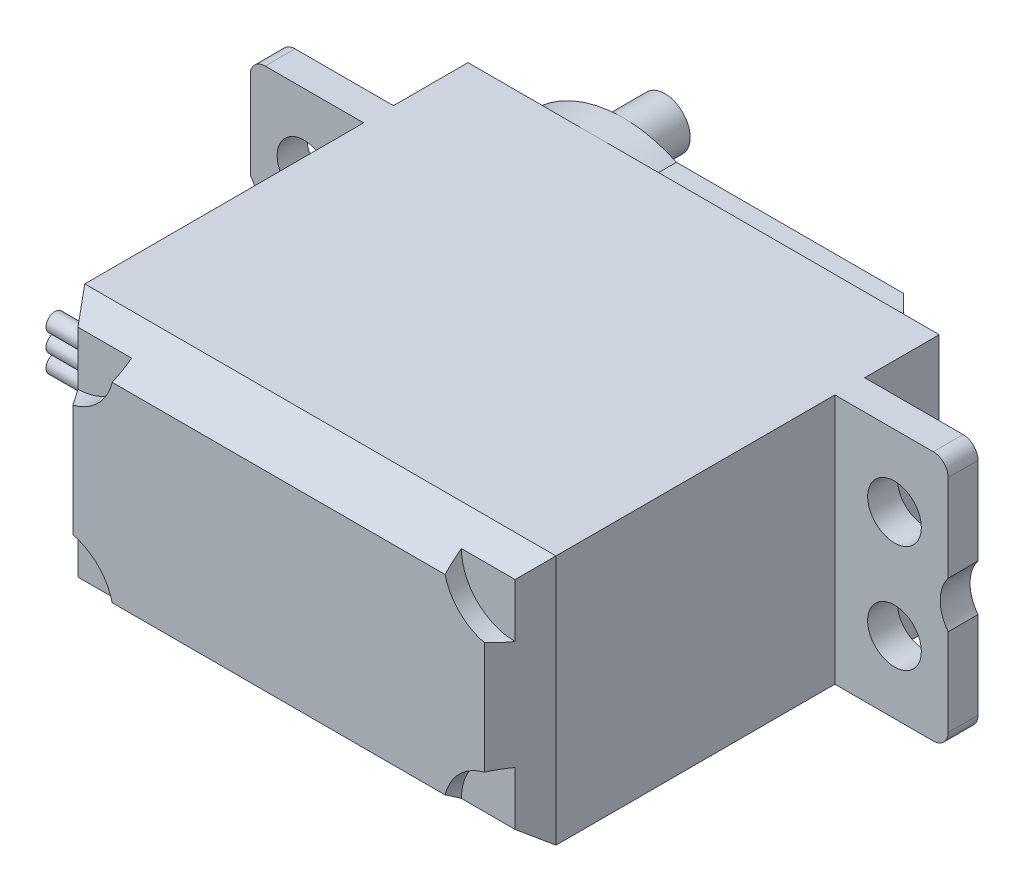
from build123d import *
from OCP.BRepFilletAPI import BRepFilletAPI_MakeChamfer

# Parameters (mm, degrees)
SKETCH1_W           = 40.132
SKETCH1_H           = 21.336
BOSS_EXTRUDE1_DEPTH = 36.195
BOSS_EXTRUDE3_DEPTH = 2.54
CHAMFER1_SIZE       = 2.54
SKETCH7_R           = 2.286
BOSS_EXTRUDE4_DEPTH = 2.54
CHAMFER2_SIZE       = 3.556
CHAMFER2_SIZE2      = 2.54
CUT_EXTRUDE11_REACH = 53.909
BOSS_EXTRUDE5_DEPTH = 1.524
SKETCH14_R          = 2.159
SKETCH14_R_2        = 1.016
BOSS_EXTRUDE6_DEPTH = 2.032
SKETCH15_R          = 3.048
SKETCH15_R_2        = 1.27
BOSS_EXTRUDE7_DEPTH = 3.556
BOSS_EXTRUDE8_DEPTH = 7.62


with BuildPart() as part:
    # Sketch1 → Boss-Extrude1 (new body)
    with BuildSketch(Plane.XY):
        with Locations((-2.744373002, 5.334902309)):
            Rectangle(SKETCH1_W, SKETCH1_H)
    extrude(amount=BOSS_EXTRUDE1_DEPTH)

    # Sketch6 → Boss-Extrude3 (add)
    with BuildSketch(Plane(origin=(0, 0, 0), x_dir=(-1, 0, 0), z_dir=(0, 0, -1))):
        with BuildLine():
            Line((7.598682871, 14.986902309), (-14.273626998, 14.986902309))
            Line((-14.273626998, 14.986902309), (-14.273626998, -4.317097691))
            Line((-14.273626998, -4.317097691), (7.598682871, -4.317097691))
            ThreePointArc((7.598682871, -4.317097691), (22.810373002, 5.334902309), (7.598682871, 14.986902309))
        make_face()
    extrude(amount=BOSS_EXTRUDE3_DEPTH)

    # Chamfer1
    chamfer1_edges = [part.edges().sort_by_distance(p)[0] for p in [
        (14.273626998, 5.334902309, -2.54),
    ]]
    chamfer(chamfer1_edges, length=CHAMFER1_SIZE - 0.0001)  # a hair under: the kernel refuses the full size

    # Sketch7 → Boss-Extrude4 (add)
    with BuildSketch(Plane(origin=(0, 0, 8.89), x_dir=(-1, 0, 0), z_dir=(0, 0, -1))):
        with BuildLine():
            Line((22.810373002, 16.002902309), (22.810373002, -5.333097691))
            Line((22.810373002, -5.333097691), (31.192373002, -5.333097691))
            ThreePointArc((31.192373002, -5.333097691), (32.090398614, -4.961123303), (32.462373002, -4.063097691))
            Line((32.462373002, -4.063097691), (32.462373002, 3.359346754))
            ThreePointArc((32.462373002, 3.359346754), (31.78454458, 5.334902309), (32.462373002, 7.310457865))
            Line((32.462373002, 7.310457865), (32.462373002, 14.732902309))
            ThreePointArc((32.462373002, 14.732902309), (32.090398614, 15.630927921), (31.192373002, 16.002902309))
            Line((31.192373002, 16.002902309), (22.810373002, 16.002902309))
        make_face()
        with Locations((27.890373002, 0.762902309)):
            Circle(SKETCH7_R, mode=Mode.SUBTRACT)
        with Locations((27.890373002, 9.906902309)):
            Circle(SKETCH7_R, mode=Mode.SUBTRACT)
    boss_extrude4 = extrude(amount=BOSS_EXTRUDE4_DEPTH)

    # Mirror1: Boss-Extrude4 across plane
    add(boss_extrude4.mirror(Plane(origin=(-2.744373002, 0, 0), x_dir=(0, 0, 1), z_dir=(1, 0, 0))))

    # Chamfer2: one chamfer whose edges measure the first distance from different faces: ONE call of the kernel's chamfer builder (chamfer() names one face for all edges)
    chamfer2_edges_1 = [part.edges().sort_by_distance(p)[0] for p in [
        (17.321626998, 5.334902309, 36.195),
    ]]
    chamfer2_side_1 = [part.faces().sort_by_distance(p)[0] for p in [
        (17.321626998, 5.334902309, 22.5425),
    ]]
    chamfer2_edges_2 = [part.edges().sort_by_distance(p)[0] for p in [
        (-2.744373002, 16.002902309, 36.195),
    ]]
    chamfer2_side_2 = [part.faces().sort_by_distance(p)[0] for p in [
        (-2.744373002, 16.002902309, 17.79911165),
    ]]
    chamfer2_edges_3 = [part.edges().sort_by_distance(p)[0] for p in [
        (-2.744373002, -5.333097691, 36.195),
    ]]
    chamfer2_side_3 = [part.faces().sort_by_distance(p)[0] for p in [
        (-2.744373002, -5.333097691, 17.79911165),
    ]]
    chamfer2_edges_4 = [part.edges().sort_by_distance(p)[0] for p in [
        (-22.810373002, 5.334902309, 36.195),
    ]]
    chamfer2_side_4 = [part.faces().sort_by_distance(p)[0] for p in [
        (-22.810373002, 5.334902309, 22.5425),
    ]]
    chamfer2 = BRepFilletAPI_MakeChamfer(part.part.solid().wrapped)
    for e in chamfer2_edges_1:
        chamfer2.Add(CHAMFER2_SIZE, CHAMFER2_SIZE2, e.wrapped, chamfer2_side_1[0].wrapped)  # the first distance lies on this face
    for e in chamfer2_edges_2:
        chamfer2.Add(CHAMFER2_SIZE, CHAMFER2_SIZE2, e.wrapped, chamfer2_side_2[0].wrapped)  # the first distance lies on this face
    for e in chamfer2_edges_3:
        chamfer2.Add(CHAMFER2_SIZE, CHAMFER2_SIZE2, e.wrapped, chamfer2_side_3[0].wrapped)  # the first distance lies on this face
    for e in chamfer2_edges_4:
        chamfer2.Add(CHAMFER2_SIZE, CHAMFER2_SIZE2, e.wrapped, chamfer2_side_4[0].wrapped)  # the first distance lies on this face
    add(Compound.cast(chamfer2.Shape()), mode=Mode.REPLACE)

    # Sketch12 → Cut-Extrude11 (cut, up to next)
    with BuildSketch(Plane.XY.offset(34.671), mode=Mode.PRIVATE) as cut_extrude11_sk1:
        with BuildLine():
            Line((-21.35894443, 14.551473738), (-21.35894443, 9.979473738))
            ThreePointArc((-21.35894443, 9.979473738), (-18.126052227, 11.318581534), (-16.78694443, 14.551473738))
            Line((-16.78694443, 14.551473738), (-21.35894443, 14.551473738))
        make_face()
    cut_extrude11_tool1 = extrude(cut_extrude11_sk1.sketch, amount=CUT_EXTRUDE11_REACH, mode=Mode.PRIVATE) & part.part
    # Sketch12 → Cut-Extrude11 (cut, up to next)
    with BuildSketch(Plane.XY.offset(34.671), mode=Mode.PRIVATE) as cut_extrude11_sk2:
        with BuildLine():
            Line((15.870198427, 14.551473738), (11.298198427, 14.551473738))
            ThreePointArc((11.298198427, 14.551473738), (12.637306223, 11.318581534), (15.870198427, 9.979473738))
            Line((15.870198427, 9.979473738), (15.870198427, 14.551473738))
        make_face()
    cut_extrude11_tool2 = extrude(cut_extrude11_sk2.sketch, amount=CUT_EXTRUDE11_REACH, mode=Mode.PRIVATE) & part.part
    # Sketch12 → Cut-Extrude11 (cut, up to next)
    with BuildSketch(Plane.XY.offset(34.671), mode=Mode.PRIVATE) as cut_extrude11_sk3:
        with BuildLine():
            Line((15.870198427, -3.88166912), (15.870198427, 0.69033088))
            ThreePointArc((15.870198427, 0.69033088), (12.637306223, -0.648776916), (11.298198427, -3.88166912))
            Line((11.298198427, -3.88166912), (15.870198427, -3.88166912))
        make_face()
    cut_extrude11_tool3 = extrude(cut_extrude11_sk3.sketch, amount=CUT_EXTRUDE11_REACH, mode=Mode.PRIVATE) & part.part
    # Sketch12 → Cut-Extrude11 (cut, up to next)
    with BuildSketch(Plane.XY.offset(34.671), mode=Mode.PRIVATE) as cut_extrude11_sk4:
        with BuildLine():
            Line((-21.35894443, -3.88166912), (-16.78694443, -3.88166912))
            ThreePointArc((-16.78694443, -3.88166912), (-18.126052227, -0.648776916), (-21.35894443, 0.69033088))
            Line((-21.35894443, 0.69033088), (-21.35894443, -3.88166912))
        make_face()
    cut_extrude11_tool4 = extrude(cut_extrude11_sk4.sketch, amount=CUT_EXTRUDE11_REACH, mode=Mode.PRIVATE) & part.part
    add(cut_extrude11_tool1.solids().sort_by_distance((-19.418527, 12.611057, 34.671))[0], mode=Mode.SUBTRACT)
    add(cut_extrude11_tool2.solids().sort_by_distance((13.929781, 12.611057, 34.671))[0], mode=Mode.SUBTRACT)
    add(cut_extrude11_tool3.solids().sort_by_distance((13.929781, -1.941252, 34.671))[0], mode=Mode.SUBTRACT)
    add(cut_extrude11_tool4.solids().sort_by_distance((-19.418527, -1.941252, 34.671))[0], mode=Mode.SUBTRACT)

    # Sketch13 → Boss-Extrude5 (add)
    with BuildSketch(Plane(origin=(0, 0, -2.54), x_dir=(-1, 0, 0), z_dir=(0, 0, -1))):
        with BuildLine():
            Line((20.651373002, 7.493902309), (18.114074518, 7.493902309))
            ThreePointArc((18.114074518, 7.493902309), (16.632501062, 9.82503037), (14.301373002, 11.306603825))
            Line((14.301373002, 11.306603825), (14.301373002, 13.843902309))
            ThreePointArc((14.301373002, 13.843902309), (12.142373002, 16.002902309), (9.983373002, 13.843902309))
            Line((9.983373002, 13.843902309), (9.983373002, 11.306603825))
            ThreePointArc((9.983373002, 11.306603825), (7.652244941, 9.82503037), (6.170671485, 7.493902309))
            Line((6.170671485, 7.493902309), (3.633373002, 7.493902309))
            ThreePointArc((3.633373002, 7.493902309), (1.474373002, 5.334902309), (3.633373002, 3.175902309))
            Line((3.633373002, 3.175902309), (6.170671485, 3.175902309))
            ThreePointArc((6.170671485, 3.175902309), (7.652244941, 0.844774249), (9.983373002, -0.636799207))
            Line((9.983373002, -0.636799207), (9.983373002, -3.174097691))
            ThreePointArc((9.983373002, -3.174097691), (12.142373002, -5.333097691), (14.301373002, -3.174097691))
            Line((14.301373002, -3.174097691), (14.301373002, -0.636799207))
            ThreePointArc((14.301373002, -0.636799207), (16.632501062, 0.844774249), (18.114074518, 3.175902309))
            Line((18.114074518, 3.175902309), (20.651373002, 3.175902309))
            ThreePointArc((20.651373002, 3.175902309), (22.810373002, 5.334902309), (20.651373002, 7.493902309))
        make_face()
    extrude(amount=BOSS_EXTRUDE5_DEPTH)

    # Sketch14 → Boss-Extrude6 (add)
    # profile 1 of 4: a face of its own
    with BuildSketch(Plane(origin=(0, 0, -4.064), x_dir=(-1, 0, 0), z_dir=(0, 0, -1))):
        with Locations((12.142373002, 13.843902309)):
            Circle(SKETCH14_R)
        with Locations((12.142373002, 13.843902309)):
            Circle(SKETCH14_R_2, mode=Mode.SUBTRACT)
    # profile 2 of 4: a face of its own
    with BuildSketch(Plane(origin=(0, 0, -4.064), x_dir=(-1, 0, 0), z_dir=(0, 0, -1))):
        with Locations((20.651373002, 5.334902309)):
            Circle(SKETCH14_R)
        with Locations((20.651373002, 5.334902309)):
            Circle(SKETCH14_R_2, mode=Mode.SUBTRACT)
    # profile 3 of 4: a face of its own
    with BuildSketch(Plane(origin=(0, 0, -4.064), x_dir=(-1, 0, 0), z_dir=(0, 0, -1))):
        with Locations((12.142373002, -3.174097691)):
            Circle(SKETCH14_R)
        with Locations((12.142373002, -3.174097691)):
            Circle(SKETCH14_R_2, mode=Mode.SUBTRACT)
    # profile 4 of 4: a face of its own
    with BuildSketch(Plane(origin=(0, 0, -4.064), x_dir=(-1, 0, 0), z_dir=(0, 0, -1))):
        with Locations(Location((3.633373002, 5.334902309, 0), (0, 0, 90))):
            Circle(SKETCH14_R)
        with Locations((3.633373002, 5.334902309)):
            Circle(SKETCH14_R_2, mode=Mode.SUBTRACT)
    extrude(amount=BOSS_EXTRUDE6_DEPTH)

    # Sketch15 → Boss-Extrude7 (add)
    with BuildSketch(Plane(origin=(0, 0, -4.064), x_dir=(-1, 0, 0), z_dir=(0, 0, -1))):
        with Locations(Location((12.142373002, 5.334902309, 0), (0, 0, 180))):
            Circle(SKETCH15_R)
        with Locations(Location((12.142373002, 5.334902309, 0), (0, 0, 180))):
            Circle(SKETCH15_R_2, mode=Mode.SUBTRACT)
    extrude(amount=BOSS_EXTRUDE7_DEPTH)

    # Sketch16 → Boss-Extrude8 (add)
    with BuildSketch(Plane.ZY.offset(22.810373002)):
        with BuildLine():
            Line((27.813, 4.616481819), (27.813, 4.529322799))
            ThreePointArc((27.813, 4.529322799), (27.559, 3.048902309), (27.305, 4.529322799))
            Line((27.305, 4.529322799), (27.305, 4.616481819))
            ThreePointArc((27.305, 4.616481819), (26.797, 5.334902309), (27.305, 6.053322799))
            Line((27.305, 6.053322799), (27.305, 6.140481819))
            ThreePointArc((27.305, 6.140481819), (27.559, 7.620902309), (27.813, 6.140481819))
            Line((27.813, 6.140481819), (27.813, 6.053322799))
            ThreePointArc((27.813, 6.053322799), (28.321, 5.334902309), (27.813, 4.616481819))
        make_face()
    extrude(amount=BOSS_EXTRUDE8_DEPTH)


solid = part.part
